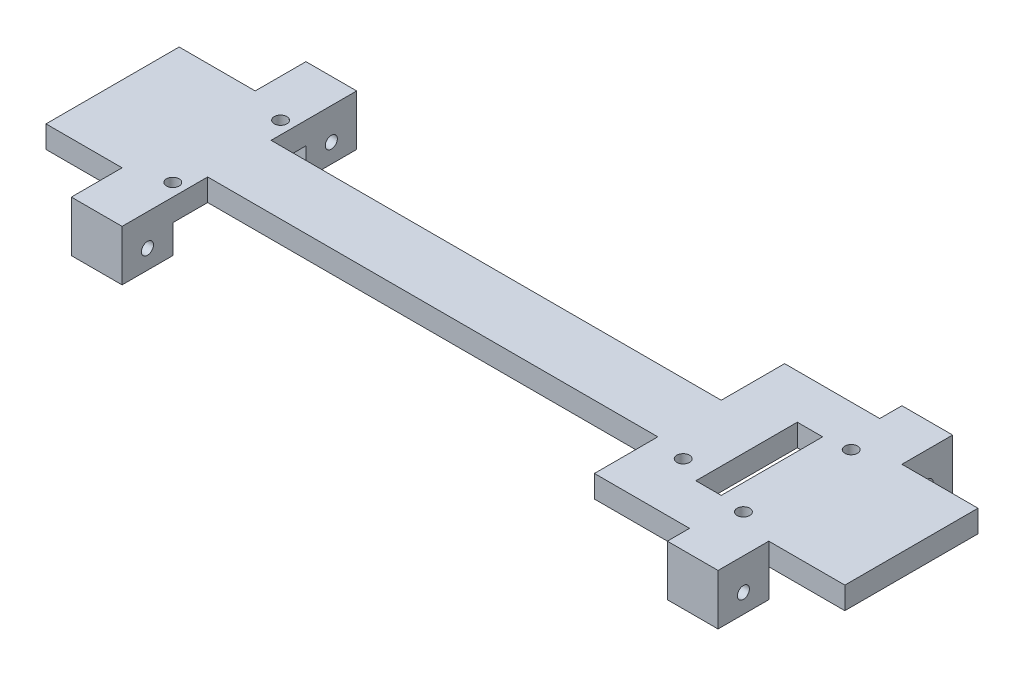
from build123d import *

# Parameters (mm, degrees)
EXTRUDE_1_DEPTH       = 3.5
SKETCH_2_R            = 1
CUT_EXTRUDE_1_DEPTH   = 128.785953845
SKETCH_3_W            = 15
SKETCH_3_H            = 10
EXTRUDE_2_DEPTH       = 3.5
SKETCH_4_W            = 4
SKETCH_4_H            = 16
CUT_EXTRUDE_2_DEPTH   = 5
FILLET_1_DEPTH        = 3.5
EXTRUDE_START         = 12
EXTRUDE_3_OUTLINE_W   = 8
EXTRUDE_3_OUTLINE_H   = 8
EXTRUDE_3_DEPTH       = 8
EXTRUDE_START_2       = 110.974937086
EXTRUDE_3_2_OUTLINE_W = 8
EXTRUDE_3_2_OUTLINE_H = 8
EXTRUDE_3_2_DEPTH     = 3.025062914
EXTRUDE_START_3       = -29
EXTRUDE_3_3_OUTLINE_W = 4.974937086
EXTRUDE_3_3_OUTLINE_H = 3.5
EXTRUDE_3_3_DEPTH     = 8.0000001
EXTRUDE_START_4       = -1e-07
EXTRUDE_3_4_OUTLINE_W = 4.974937086
EXTRUDE_3_4_OUTLINE_H = 3.5
EXTRUDE_3_4_DEPTH     = 8.0000001
EXTRUDE_START_5       = 4.5
EXTRUDE_3_5_OUTLINE_W = 4.974937086
EXTRUDE_3_5_OUTLINE_H = 4.5
EXTRUDE_3_5_DEPTH     = 3.5
EXTRUDE_3_6_OUTLINE_W = 4.974937086
EXTRUDE_3_6_OUTLINE_H = 4.5
EXTRUDE_3_6_DEPTH     = 3.4999999
EXTRUDE_START_6       = -4.5
EXTRUDE_3_7_DEPTH     = 5.5
SKETCH_6_R            = 0.95
CUT_EXTRUDE_3_DEPTH   = 118.716821353
SKETCH_7_R            = 1
CUT_EXTRUDE_4_DEPTH   = 130.541499268


with BuildPart() as part:
    # 草图1 → 凸台-拉伸1 (new body)
    with BuildSketch(Plane(origin=(0, 0, 0), x_dir=(1, 0, 0), z_dir=(0, 1, 0))):
        Polygon((106, 15.5), (106, 21), (126, 21), (126, 0), (106, 0), (106, 5.5), (20, 5.5), (20, 0), (0, 0), (0, 21), (20, 21), (20, 15.5), align=None)
    extrude(amount=EXTRUDE_1_DEPTH)

    # 草图2 → 切除-拉伸1 (cut, through all)
    with BuildSketch(Plane(origin=(0, 3.5, 0), x_dir=(1, 0, 0), z_dir=(0, 1, 0))):
        with Locations(Location((108, 19, 0), (0, 0, 270))):
            Circle(SKETCH_2_R)
        with Locations(Location((108, 2, 0), (0, 0, 90))):
            Circle(SKETCH_2_R)
        with Locations(Location((18, 19, 0), (0, 0, 90))):
            Circle(SKETCH_2_R)
        with Locations(Location((18, 2, 0), (0, 0, 270))):
            Circle(SKETCH_2_R)
    extrude(amount=-CUT_EXTRUDE_1_DEPTH, mode=Mode.SUBTRACT)

    # 草图3 → 凸台-拉伸2 (add)
    with BuildSketch(Plane(origin=(0, 0, 0), x_dir=(-1, 0, 0), z_dir=(0, -1, 0))):
        with Locations((-98.5, 20.5)):
            Rectangle(SKETCH_3_W, SKETCH_3_H)
        with Locations((-98.5, 0.5)):
            Rectangle(SKETCH_3_W, SKETCH_3_H)
    extrude(amount=-EXTRUDE_2_DEPTH)

    # 草图4 → 切除-拉伸2 (cut)
    with BuildSketch(Plane(origin=(0, 0, 0), x_dir=(-1, 0, 0), z_dir=(0, -1, 0))):
        with Locations((-102, 10.5)):
            Rectangle(SKETCH_4_W, SKETCH_4_H)
    extrude(amount=-CUT_EXTRUDE_2_DEPTH, mode=Mode.SUBTRACT)

    # 圆角1: read off the stored shape, not the designer's step
    # 圆角1 outline → 圆角1 (add)
    with BuildSketch(Plane(origin=(0, 0, 0), x_dir=(1, 0, 0), z_dir=(0, 1, 0))):
        with BuildLine():
            Line((106, 21), (110.974937186, 21))
            add(Edge.make_bspline(
                [(110.974937186, 21), (106.452267017, 21), (106, 25.5)],
                knots=[0, 0, 0, 1, 1, 1], degree=2, weights=[1, 0.052631579, 1]))
            Line((106, 25.5), (106, 21))
        make_face()
        with BuildLine():
            add(Edge.make_bspline(
                [(110.974937186, 0), (106.452267017, 0), (106, -4.5)],
                knots=[0, 0, 0, 1, 1, 1], degree=2, weights=[1, 0.052631579, 1]))
            Line((110.974937186, 0), (106, 0))
            Line((106, 0), (106, -4.5))
        make_face()
    extrude(amount=FILLET_1_DEPTH)

    # 凸台-拉伸3: read off the stored shape, not the designer's step
    # 凸台-拉伸3 outline → 凸台-拉伸3 (add)
    with BuildSketch(Plane.YZ.offset(EXTRUDE_START)):
        with Locations((-0.5, -25)):
            Rectangle(EXTRUDE_3_OUTLINE_W, EXTRUDE_3_OUTLINE_H)
        with Locations((-0.5, 4)):
            Rectangle(EXTRUDE_3_OUTLINE_W, EXTRUDE_3_OUTLINE_H)
    extrude(amount=EXTRUDE_3_DEPTH)

    # Extrude 3 2 outline → Extrude 3 2 (add)
    with BuildSketch(Plane.YZ.offset(EXTRUDE_START_2)):
        with Locations((-0.5, -25)):
            Rectangle(EXTRUDE_3_2_OUTLINE_W, EXTRUDE_3_2_OUTLINE_H)
        with Locations((-0.5, 4)):
            Rectangle(EXTRUDE_3_2_OUTLINE_W, EXTRUDE_3_2_OUTLINE_H)
    extrude(amount=EXTRUDE_3_2_DEPTH)

    # Extrude 3 3 outline → Extrude 3 3 (add)
    with BuildSketch(Plane.XY.offset(EXTRUDE_START_3)):
        with Locations((108.487468543, 1.75)):
            Rectangle(EXTRUDE_3_3_OUTLINE_W, EXTRUDE_3_3_OUTLINE_H)
    extrude(amount=EXTRUDE_3_3_DEPTH)

    # Extrude 3 4 outline → Extrude 3 4 (add)
    with BuildSketch(Plane.XY.offset(EXTRUDE_START_4)):
        with Locations((108.487468543, 1.75)):
            Rectangle(EXTRUDE_3_4_OUTLINE_W, EXTRUDE_3_4_OUTLINE_H)
    extrude(amount=EXTRUDE_3_4_DEPTH)

    # Extrude 3 5 outline → Extrude 3 5 (add)
    with BuildSketch(Plane.XY.offset(EXTRUDE_START_5)):
        with Locations((108.487468543, -2.25)):
            Rectangle(EXTRUDE_3_5_OUTLINE_W, EXTRUDE_3_5_OUTLINE_H)
    extrude(amount=EXTRUDE_3_5_DEPTH)

    # Extrude 3 6 outline → Extrude 3 6 (add)
    with BuildSketch(Plane.XY.offset(EXTRUDE_START_3)):
        with Locations((108.487468543, -2.25)):
            Rectangle(EXTRUDE_3_6_OUTLINE_W, EXTRUDE_3_6_OUTLINE_H)
    extrude(amount=EXTRUDE_3_6_DEPTH)

    # Extrude 3 7 outline → Extrude 3 7 (add)
    with BuildSketch(Plane(origin=(0, 0, 0), x_dir=(1, 0, 0), z_dir=(0, 1, 0)).offset(EXTRUDE_START_6)):
        with BuildLine():
            Line((110.974937186, 21), (114, 21))
            Line((114, 21), (114, 29))
            Line((114, 29), (106, 29))
            Line((106, 29), (106, 25.5))
            add(Edge.make_bspline(
                [(106, 25.5), (106.009269507, 25.407769569), (106.671100156, 24.750288943), (106.886833575, 24.535973478), (107.15337097, 24.28118269), (107.717435122, 23.741977487), (108.385645722, 23.137556797), (109.053934894, 22.533065037), (109.646910819, 22.025691943), (109.949857187, 21.766479336), (110.199076342, 21.562212351), (110.885012382, 21), (110.974937186, 21)],
                knots=[0, 0, 0, 0.15, 0.15, 0.25, 0.25, 0.5, 0.5, 0.75, 0.75, 0.857142857, 0.857142857, 1, 1, 1], degree=2))
        make_face()
        with BuildLine():
            Line((114, -8), (114, 0))
            Line((114, 0), (110.974937186, 0))
            add(Edge.make_bspline(
                [(110.974937186, 0), (110.882242115, 0), (110.161874087, -0.592765119), (109.92705955, -0.785985614), (109.646892177, -1.025707894), (109.053983358, -1.533024119), (108.385771306, -2.137443203), (107.717480681, -2.741933357), (107.153353234, -3.281199644), (106.86514531, -3.556706213), (106.636980311, -3.784249442), (106.00899248, -4.41052595), (106, -4.5)],
                knots=[0, 0, 0, 0.15, 0.15, 0.25, 0.25, 0.5, 0.5, 0.75, 0.75, 0.857142857, 0.857142857, 1, 1, 1], degree=2))
            Line((106, -4.5), (106, -8))
            Line((106, -8), (114, -8))
        make_face()
    extrude(amount=EXTRUDE_3_7_DEPTH)

    # 草图6 → 切除-拉伸3 (cut, through all)
    with BuildSketch(Plane.ZY.offset(-12)):
        with Locations(Location((-25, -1.5, 0), (0, 0, 238.243136141))):
            Circle(SKETCH_6_R)
        with Locations((4, -1.5)):
            Circle(SKETCH_6_R)
    extrude(amount=-CUT_EXTRUDE_3_DEPTH, mode=Mode.SUBTRACT)

    # 草图7 → 切除-拉伸4 (cut, through all)
    with BuildSketch(Plane(origin=(0, 3.5, 0), x_dir=(1, 0, 0), z_dir=(0, 1, 0))):
        with Locations(Location((96, 4.5, 0), (0, 0, 270))):
            Circle(SKETCH_7_R)
    extrude(amount=-CUT_EXTRUDE_4_DEPTH, mode=Mode.SUBTRACT)


solid = part.part
